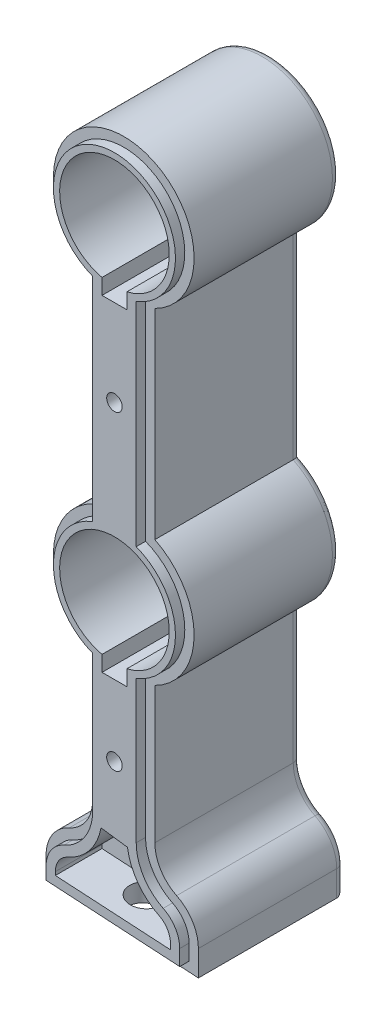
from build123d import *

# Parameters (mm, degrees)
SKETCH_15_R          = 9.05
SKETCH_15_R_2        = 6.25
EXTRUDE_4_DEPTH      = 20
EXTRUDE_4_2_DEPTH    = 20
SKETCH_16_W          = 8
SKETCH_16_H          = 25.763929046
EXTRUDE_4_3_DEPTH    = 20
EXTRUDE_5_DEPTH      = 20
FILLET_5_R           = 5
FILLET_6_R           = 5
FILLET_7_R           = 1
CUT_EXTRUDE_START    = -18.8
SKETCH_18_R          = 7.05
SKETCH_18_R_2        = 6.25
CUT_EXTRUDE_2_DEPTH  = 18.8
CUT_EXTRUDE_START_2  = -1.2
CUT_EXTRUDE_3_DEPTH  = 1.2
SKETCH_20_R          = 1
CUT_EXTRUDE_6_DEPTH  = 8
SKETCH_21_R          = 2.5
SKETCH_21_R_2        = 2
CUT_EXTRUDE_7_DEPTH  = 4
SKETCH_22_R          = 1.6
SKETCH_22_R_2        = 2
CUT_EXTRUDE_8_DEPTH  = 4
EXTRUDE_5_2_DEPTH    = 1
CUT_EXTRUDE_START_3  = -6
CUT_EXTRUDE_9_DEPTH  = 6
CUT_EXTRUDE_START_4  = -1
CUT_EXTRUDE_10_DEPTH = 1
SKETCH_26_W          = 3.2
SKETCH_26_H          = 2
CUT_EXTRUDE_11_DEPTH = 18.8


with BuildPart() as part:
    # Эскиз15 → Extrude 4 (new body)
    with BuildSketch(Plane.XY):
        with Locations((0, 21)):
            Circle(SKETCH_15_R)
        with Locations((0, 21)):
            Circle(SKETCH_15_R_2, mode=Mode.SUBTRACT)
    extrude(amount=EXTRUDE_4_DEPTH)



with BuildPart() as body_2:
    # Эскиз15 → Extrude 4 2 (new body)
    with BuildSketch(Plane.XY):
        with Locations((0, -21)):
            Circle(SKETCH_15_R)
        with Locations((0, -21)):
            Circle(SKETCH_15_R_2, mode=Mode.SUBTRACT)
    extrude(amount=EXTRUDE_4_2_DEPTH)


with BuildPart() as part_1:
    add(part.part)

    add(body_2.part)  # Extrude 4 3 merges body 2
    # Эскиз16 → Extrude 4 3 (add)
    with BuildSketch(Plane.XY.offset(20)):
        Polygon((-4, -29.118035477), (-4, -58.118035477), (4, -58.590520728), (4, -29.118035477), align=None)
        Rectangle(SKETCH_16_W, SKETCH_16_H)
    extrude(amount=-EXTRUDE_4_3_DEPTH)

    # Эскиз17 → Extrude 5 (add)
    with BuildSketch(Plane(origin=(0, 0, 0), x_dir=(-1, 0, 0), z_dir=(0, 0, -1))):
        Polygon((4, -58.118035477), (10, -57.763671538), (10, -49.763671538), (-9.6, -50.921260403), (-9.6, -58.921260403), (-4, -58.590520728), align=None)
    extrude(amount=-EXTRUDE_5_DEPTH)

    # Скругление5
    fillet_5_edges = [part_1.edges().sort_by_distance(p)[0] for p in [
        (9.6, -50.921260403, 10),
        (-10, -49.763671538, 10),
    ]]
    fillet(fillet_5_edges, radius=FILLET_5_R)

    # Скругление6
    fillet_6_edges = [part_1.edges().sort_by_distance(p)[0] for p in [
        (-4, -50.118035477, 10),
        (4, -50.590520728, 10),
    ]]
    fillet(fillet_6_edges, radius=FILLET_6_R)

    # Скругление7
    fillet_7_edges = [part_1.edges().sort_by_distance(p)[0] for p in [
        (0, 30.05, 0),
        (-10, -56.415679585, 0),
        (-0.2, -58.342465971, 0),
        (9.6, -57.277965168, 0),
        (8.842640687, -52.988918622, 0),
        (4.757359313, -49.300443516, 0),
        (-9.183300133, -52.329074844, 0),
        (-4.816699867, -48.641149029, 0),
        (4, -37.886363841, 0),
        (-4, -37.510285859, 0),
        (9.05, -21, 0),
        (-6.25, -21, 0),
        (-9.05, -21, 0),
        (-6.25, 21, 0),
        (4, 0, 0),
        (-4, 0, 0),
    ]]
    fillet(fillet_7_edges, radius=FILLET_7_R)

    # Эскиз18 → Вырез-Вытянуть-Тонкостенный2 (cut)
    # profile 1 of 2: a face of its own
    with BuildSketch(Plane.XY.offset(20).offset(CUT_EXTRUDE_START)):
        with Locations((0, -21)):
            Circle(SKETCH_18_R)
        with Locations((0, -21)):
            Circle(SKETCH_18_R_2, mode=Mode.SUBTRACT)
    # profile 2 of 2: a face of its own
    with BuildSketch(Plane.XY.offset(20).offset(CUT_EXTRUDE_START)):
        with Locations((0, 21)):
            Circle(SKETCH_18_R)
        with Locations((0, 21)):
            Circle(SKETCH_18_R_2, mode=Mode.SUBTRACT)
    extrude(amount=CUT_EXTRUDE_2_DEPTH, mode=Mode.SUBTRACT)

    # Эскиз19 → Вырез-Вытянуть-Тонкостенный3 (cut)
    with BuildSketch(Plane.XY.offset(20).offset(CUT_EXTRUDE_START_2)):
        with BuildLine():
            Line((-10, -55.067687632), (-10, -57.763671538))
            Line((-10, -57.763671538), (9.6, -58.921260403))
            Line((9.6, -58.921260403), (9.6, -55.634669933))
            ThreePointArc((9.6, -55.634669933), (8.842640687, -52.988918622), (6.8, -51.144681069))
            ThreePointArc((6.8, -51.144681069), (4.757359313, -49.300443516), (4, -46.654692205))
            Line((4, -46.654692205), (4, -29.118035477))
            ThreePointArc((4, -29.118035477), (9.05, -21), (4, -12.881964523))
            Line((4, -12.881964523), (4, 12.881964523))
            ThreePointArc((4, 12.881964523), (0, 30.05), (-4, 12.881964523))
            Line((-4, 12.881964523), (-4, -12.881964523))
            ThreePointArc((-4, -12.881964523), (-9.05, -21), (-4, -29.118035477))
            Line((-4, -29.118035477), (-4, -45.902536242))
            ThreePointArc((-4, -45.902536242), (-4.816699867, -48.641149029), (-7, -50.485111937))
            ThreePointArc((-7, -50.485111937), (-9.183300133, -52.329074844), (-10, -55.067687632))
        make_face()
        with BuildLine():
            Line((-8.8, -55.067687632), (-8.8, -56.632453251))
            Line((-8.8, -56.632453251), (8.4, -57.648296541))
            Line((8.4, -57.648296541), (8.4, -55.634669933))
            ThreePointArc((8.4, -55.634669933), (7.824406922, -53.623898937), (6.272, -52.222278396))
            ThreePointArc((6.272, -52.222278396), (3.739125548, -49.935423831), (2.8, -46.654692205))
            Line((2.8, -46.654692205), (2.8, -28.333655296))
            ThreePointArc((2.8, -28.333655296), (7.85, -21), (2.8, -13.666344704))
            Line((2.8, -13.666344704), (2.8, 13.666344704))
            ThreePointArc((2.8, 13.666344704), (0, 28.85), (-2.8, 13.666344704))
            Line((-2.8, 13.666344704), (-2.8, -13.666344704))
            ThreePointArc((-2.8, -13.666344704), (-7.85, -21), (-2.8, -28.333655296))
            Line((-2.8, -28.333655296), (-2.8, -45.902536242))
            ThreePointArc((-2.8, -45.902536242), (-3.812707835, -49.298416098), (-6.52, -51.584930104))
            ThreePointArc((-6.52, -51.584930104), (-8.179308101, -52.986341913), (-8.8, -55.067687632))
        make_face(mode=Mode.SUBTRACT)
    extrude(amount=CUT_EXTRUDE_3_DEPTH, mode=Mode.SUBTRACT)

    # Эскиз20 → Вырез-Вытянуть6 (cut)
    with BuildSketch(Plane.XY.offset(20)):
        with Locations((0, 1)):
            Circle(SKETCH_20_R)
        with Locations((0, -39)):
            Circle(SKETCH_20_R)
    extrude(amount=-CUT_EXTRUDE_6_DEPTH, mode=Mode.SUBTRACT)

    # Эскиз21 → Вырез-Вытянуть7 (cut)
    with BuildSketch(Plane(origin=(-3.434462011, -58.151436522, 0), x_dir=(0.998260468936824, -0.058957918535447094, 0), z_dir=(-0.05895791853544709, -0.9982604689368239, 0))):
        with Locations((3.242175373, 10)):
            Circle(SKETCH_21_R)
        with Locations((3.242175373, 16)):
            Circle(SKETCH_21_R_2)
    extrude(amount=-CUT_EXTRUDE_7_DEPTH, mode=Mode.SUBTRACT)

    # Эскиз22 → Вырез-Вытянуть8 (cut)
    with BuildSketch(Plane(origin=(-3.198630336, -54.158394646, 0), x_dir=(0.998260468936824, -0.058957918535447115, 0), z_dir=(-0.05895791853544711, -0.9982604689368239, 0))):
        with Locations((3.242175373, 10)):
            Circle(SKETCH_22_R)
        with Locations((3.242175373, 16)):
            Circle(SKETCH_22_R_2)
    extrude(amount=-CUT_EXTRUDE_8_DEPTH, mode=Mode.SUBTRACT)

    # Эскиз23 → Extrude 5 2 (add)
    with BuildSketch(Plane.XY.offset(20)):
        with BuildLine():
            ThreePointArc((-6.52, -51.584930104), (-8.179308101, -52.986341913), (-8.8, -55.067687632))
            Line((-8.8, -55.067687632), (-8.8, -56.632453251))
            Line((-8.8, -56.632453251), (8.4, -57.648296541))
            Line((8.4, -57.648296541), (8.4, -55.634669933))
            ThreePointArc((8.4, -55.634669933), (7.824406922, -53.623898937), (6.272, -52.222278396))
            ThreePointArc((6.272, -52.222278396), (3.739125548, -49.935423831), (2.8, -46.654692205))
            Line((2.8, -46.654692205), (-2.8, -45.902536242))
            ThreePointArc((-2.8, -45.902536242), (-3.812707835, -49.298416098), (-6.52, -51.584930104))
        make_face()
        with BuildLine():
            ThreePointArc((-6.04, -52.68474827), (-7.175316069, -53.643608982), (-7.6, -55.067687632))
            Line((-7.6, -55.067687632), (-7.6, -55.501234964))
            Line((-7.6, -55.501234964), (7.2, -56.375332679))
            Line((7.2, -56.375332679), (7.2, -55.634669933))
            ThreePointArc((7.2, -55.634669933), (6.806173157, -54.258879251), (5.744, -53.299875724))
            ThreePointArc((5.744, -53.299875724), (3.018230754, -51.011116965), (1.676290149, -47.714538428))
            Line((1.676290149, -47.714538428), (-1.725140216, -47.25768019))
            ThreePointArc((-1.725140216, -47.25768019), (-3.207646792, -50.507820632), (-6.04, -52.68474827))
        make_face(mode=Mode.SUBTRACT)
    extrude(amount=EXTRUDE_5_2_DEPTH)

    # Эскиз24 → Вырез-Вытянуть9 (cut)
    with BuildSketch(Plane.XY.offset(20).offset(CUT_EXTRUDE_START_3)):
        with BuildLine():
            Line((7.2, -56.375332679), (7.2, -55.634669933))
            ThreePointArc((7.2, -55.634669933), (6.806173157, -54.258879251), (5.744, -53.299875724))
            ThreePointArc((5.744, -53.299875724), (3.018230754, -51.011116965), (1.676290149, -47.714538428))
            Line((1.676290149, -47.714538428), (-1.725140216, -47.25768019))
            ThreePointArc((-1.725140216, -47.25768019), (-3.207646792, -50.507820632), (-6.04, -52.68474827))
            ThreePointArc((-6.04, -52.68474827), (-7.175316069, -53.643608982), (-7.6, -55.067687632))
            Line((-7.6, -55.067687632), (-7.6, -55.501234964))
            Line((-7.6, -55.501234964), (7.2, -56.375332679))
        make_face()
    extrude(amount=CUT_EXTRUDE_9_DEPTH, mode=Mode.SUBTRACT)

    # Эскиз25 → Вырез-Вытянуть10 (cut)
    with BuildSketch(Plane.XY.offset(21).offset(CUT_EXTRUDE_START_4)):
        with BuildLine():
            Line((2.8, -46.654692205), (-2.8, -45.902536242))
            ThreePointArc((-2.8, -45.902536242), (-3.812707835, -49.298416098), (-6.52, -51.584930104))
            ThreePointArc((-6.52, -51.584930104), (-8.179308101, -52.986341913), (-8.8, -55.067687632))
            Line((-8.8, -55.067687632), (-8.8, -56.632453251))
            Line((-8.8, -56.632453251), (8.4, -57.648296541))
            Line((8.4, -57.648296541), (8.4, -55.634669933))
            ThreePointArc((8.4, -55.634669933), (7.824406922, -53.623898937), (6.272, -52.222278396))
            ThreePointArc((6.272, -52.222278396), (3.739125548, -49.935423831), (2.8, -46.654692205))
        make_face()
    extrude(amount=CUT_EXTRUDE_10_DEPTH, mode=Mode.SUBTRACT)

    # Эскиз26 → Вырез-Вытянуть11 (cut)
    with BuildSketch(Plane.XY.offset(20)):
        with Locations((0, 13.133960385)):
            Rectangle(SKETCH_26_W, SKETCH_26_H)
        with Locations((0, -28.866039615)):
            Rectangle(SKETCH_26_W, SKETCH_26_H)
    extrude(amount=-CUT_EXTRUDE_11_DEPTH, mode=Mode.SUBTRACT)


solid = part_1.part
